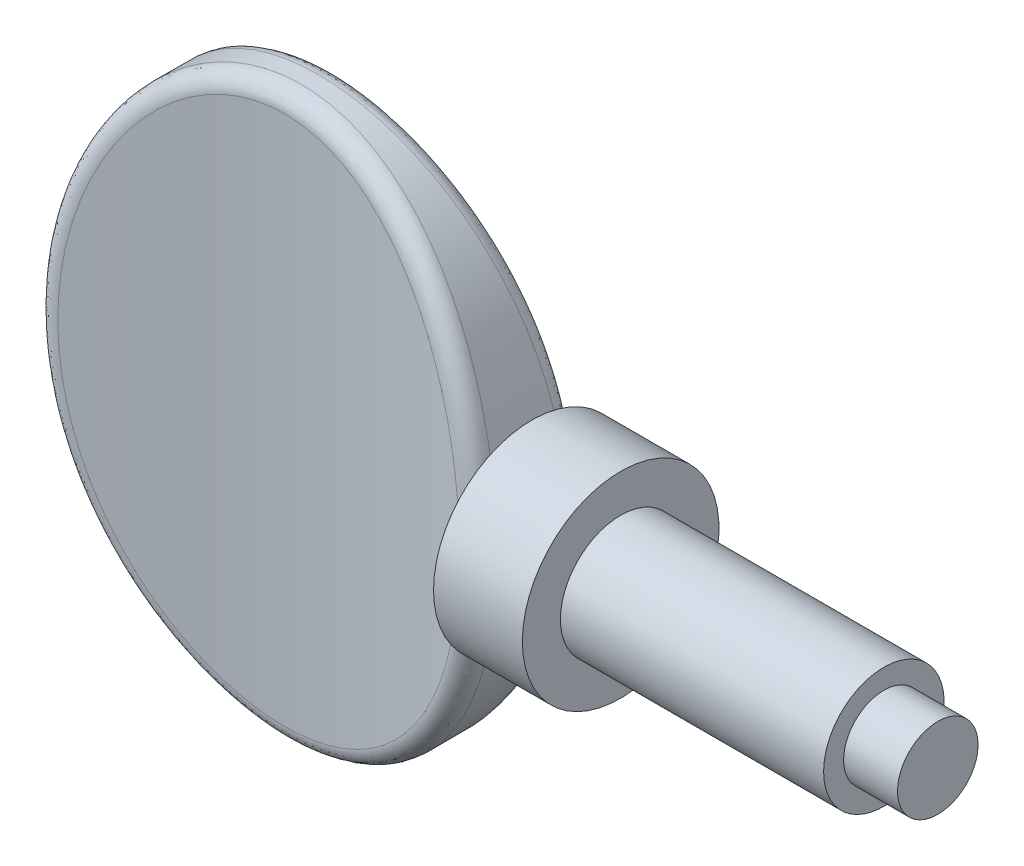
from build123d import *

# Parameters (mm, degrees)
SKETCH1_RX              = 11.303
SKETCH1_RY              = 8.889999999999999
EXTRUDE1_DEPTH          = 2.286
CUT_EXTRUDE1_DEPTH      = 15.560759080487529
CUT_EXTRUDE1_DEPTH_BACK = 15.560759080487529
SKETCH2_OUTSIDE_W       = 25.603999999999996
SKETCH2_OUTSIDE_H       = 12.396
FILLET3_R               = 0.6773333333333333


with BuildPart() as part:
    # Sketch1 → Extrude1 (new, symmetric)
    with BuildSketch(Plane.XY):
        with Locations(Location((0, 0), (0, 0, 90))):
            Ellipse(SKETCH1_RX, SKETCH1_RY)
    extrude(amount=EXTRUDE1_DEPTH, both=True)

    # Sketch2 outside → Cut-Extrude1 (cut, two sides: drawn at the far end of the back side and taken through both)
    with BuildSketch(Plane(origin=(0, 0, 0), x_dir=(1, 0, 0), z_dir=(0, 1, 0)).offset(-CUT_EXTRUDE1_DEPTH_BACK)):
        Rectangle(SKETCH2_OUTSIDE_W, SKETCH2_OUTSIDE_H)
        with BuildLine():
            Line((-8.889999999999999, 2.286), (-8.889999999999999, -2.286))
            ThreePointArc((-8.889999999999999, -2.286), (1.94e-15, -1.0159999999999982), (8.889999999999999, -2.286))
            Line((8.889999999999999, -2.286), (8.889999999999999, 2.286))
            ThreePointArc((8.889999999999999, 2.286), (1.94e-15, 1.0159999999999982), (-8.889999999999999, 2.286))
        make_face(mode=Mode.SUBTRACT)
    extrude(amount=CUT_EXTRUDE1_DEPTH + CUT_EXTRUDE1_DEPTH_BACK, mode=Mode.SUBTRACT)

    # Fillet3
    fillet3_edges = [part.edges().sort_by_distance(p)[0] for p in [
        (-6.499256061e-08, -11.302999999991183, 1.0159999999964504),
        (8.835220095e-08, -11.302999999991183, -1.0159999999964522),
    ]]
    fillet(fillet3_edges, radius=FILLET3_R)

    # Sketch3 → Revolve1 (revolve)
    with BuildSketch(Plane(origin=(0, 0, 0), x_dir=(1, 0, 0), z_dir=(0, 1, 0))):
        with BuildLine():
            Line((12.445999999999996, 3.9369999999999994), (12.445999999999996, 2.413))
            Line((12.445999999999996, 2.413), (22.986999999999995, 2.4129999999999994))
            Line((22.986999999999995, 2.4129999999999994), (22.986999999999995, 1.6128999999999998))
            Line((22.986999999999995, 1.6128999999999998), (25.145999999999994, 1.6129))
            Line((25.145999999999994, 1.6129), (25.145999999999994, 0))
            Line((25.145999999999994, 0), (7.236423048052516, 0))
            Line((7.236423048052516, 0), (7.236423048052516, 1.8516557328217895))
            ThreePointArc((7.236423048052516, 1.8516557328217895), (8.426438076724871, 2.6063068114075874), (8.889999999999999, 3.9370000000000003))
            Line((8.889999999999999, 3.9370000000000003), (12.445999999999996, 3.9369999999999994))
        make_face()
    revolve(axis=Axis((0, 0, 0), (1, 0, 0)))


solid = part.part
